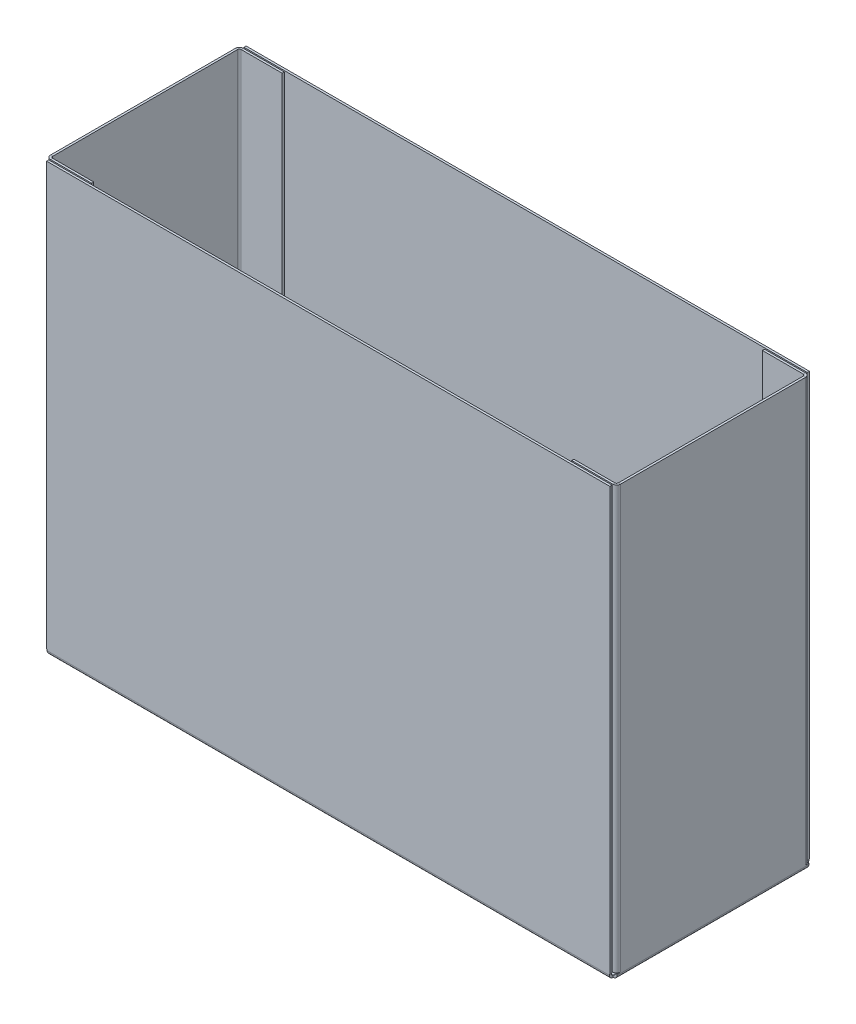
from build123d import *

# Parameters (mm, degrees)
SKETCH1_W                    = 200
SKETCH1_H                    = 70
BOSS_EXTRUDE1_DEPTH          = 150
CONVERT_SOLID1_START         = 1.36
CONVERT_SOLID1_DEPTH         = 197.28
CONVERT_SOLID1_START_2       = -1
CONVERT_SOLID1_2_DEPTH       = 202
CONVERT_SOLID1_3_DEPTH       = 2.184264069
CONVERT_SOLID1_START_3       = 198.815735931
CONVERT_SOLID1_4_DEPTH       = 2.184264069
CONVERT_SOLID1_START_4       = 1.184264069
CONVERT_SOLID1_5_DEPTH       = 197.631471862
CONVERT_SOLID1_6_DEPTH       = 0.175735931
CONVERT_SOLID1_START_5       = 198.64
CONVERT_SOLID1_7_DEPTH       = 0.175735931
CONVERT_SOLID1_START_6       = -68.815735931
CONVERT_SOLID1_8_DEPTH       = 67.631471862
CONVERT_SOLID1_9_DEPTH       = 0.175735931
CONVERT_SOLID1_START_7       = -1.36
CONVERT_SOLID1_10_DEPTH      = 0.175735931
EDGE_FLANGE1_STRIP_W         = 4.24
EDGE_FLANGE1_STRIP_H         = 0.76
EDGE_FLANGE1_STRIP_CUT_DEPTH = 148.269865
EDGE_FLANGE1_DEPTH           = 148.269865
MIRROR2_COPY_1_SKETCH_W      = 4.24
MIRROR2_COPY_1_SKETCH_H      = 0.76
MIRROR2_COPY_1_DEPTH         = 148.269865
MIRROR2_COPY_2_DEPTH         = 148.269865


with BuildPart() as part:
    # Sketch1 → Boss-Extrude1 (new body)
    with BuildSketch(Plane(origin=(0, 0, 0), x_dir=(1, 0, 0), z_dir=(0, 1, 0))):
        with Locations((100, 35)):
            Rectangle(SKETCH1_W, SKETCH1_H)
    extrude(amount=BOSS_EXTRUDE1_DEPTH)

    # Convert-Solid1: read off the stored shape, not the designer's step
    # Convert-Solid1 outline → Convert-Solid1 (cut)
    with BuildSketch(Plane.YZ.offset(CONVERT_SOLID1_START)):
        with BuildLine():
            Line((150, -0.76), (1.36, -0.76))
            ThreePointArc((1.36, -0.76), (0.935735931, -0.935735931), (0.76, -1.36))
            Line((0.76, -1.36), (0.76, -68.64))
            ThreePointArc((0.76, -68.64), (0.935735931, -69.064264069), (1.36, -69.24))
            Line((1.36, -69.24), (150, -69.24))
            Line((150, -69.24), (150, -0.76))
        make_face()
    extrude(amount=CONVERT_SOLID1_DEPTH, mode=Mode.SUBTRACT)

    # Convert-Solid1 2 outline → Convert-Solid1 2 (cut)
    with BuildSketch(Plane.YZ.offset(CONVERT_SOLID1_START_2)):
        with BuildLine():
            Line((0.76, -1.36), (1.730135, -1.36))
            Line((1.730135, -1.36), (1.730135, -1.184264069))
            Line((1.730135, -1.184264069), (150, -1.184264069))
            Line((150, -1.184264069), (150, -0.76))
            Line((150, -0.76), (1.36, -0.76))
            ThreePointArc((1.36, -0.76), (0.935735931, -0.935735931), (0.76, -1.36))
        make_face()
        with BuildLine():
            Line((1.730135, -68.64), (0.76, -68.64))
            ThreePointArc((0.76, -68.64), (0.935735931, -69.064264069), (1.36, -69.24))
            Line((1.36, -69.24), (150, -69.24))
            Line((150, -69.24), (150, -68.815735931))
            Line((150, -68.815735931), (1.730135, -68.815735931))
            Line((1.730135, -68.815735931), (1.730135, -68.64))
        make_face()
    extrude(amount=CONVERT_SOLID1_2_DEPTH, mode=Mode.SUBTRACT)

    # Convert-Solid1 3 outline → Convert-Solid1 3 (cut)
    with BuildSketch(Plane.YZ.offset(CONVERT_SOLID1_START_2)):
        with BuildLine():
            Line((150, -69.24), (1.36, -69.24))
            ThreePointArc((1.36, -69.24), (0.935735931, -69.064264069), (0.76, -68.64))
            Line((0.76, -68.64), (0, -68.64))
            Line((0, -68.64), (0, -70))
            Line((0, -70), (150, -70))
            Line((150, -70), (150, -69.24))
        make_face()
        with BuildLine():
            Line((0, 0), (0, -1.36))
            Line((0, -1.36), (0.76, -1.36))
            ThreePointArc((0.76, -1.36), (0.935735931, -0.935735931), (1.36, -0.76))
            Line((1.36, -0.76), (150, -0.76))
            Line((150, -0.76), (150, 0))
            Line((150, 0), (0, 0))
        make_face()
    extrude(amount=CONVERT_SOLID1_3_DEPTH, mode=Mode.SUBTRACT)

    # Convert-Solid1 4 outline → Convert-Solid1 4 (cut)
    with BuildSketch(Plane.YZ.offset(CONVERT_SOLID1_START_3)):
        with BuildLine():
            Line((150, -69.24), (1.36, -69.24))
            ThreePointArc((1.36, -69.24), (0.935735931, -69.064264069), (0.76, -68.64))
            Line((0.76, -68.64), (0, -68.64))
            Line((0, -68.64), (0, -70))
            Line((0, -70), (150, -70))
            Line((150, -70), (150, -69.24))
        make_face()
        with BuildLine():
            Line((0, 0), (0, -1.36))
            Line((0, -1.36), (0.76, -1.36))
            ThreePointArc((0.76, -1.36), (0.935735931, -0.935735931), (1.36, -0.76))
            Line((1.36, -0.76), (150, -0.76))
            Line((150, -0.76), (150, 0))
            Line((150, 0), (0, 0))
        make_face()
    extrude(amount=CONVERT_SOLID1_4_DEPTH, mode=Mode.SUBTRACT)

    # Convert-Solid1 5 outline → Convert-Solid1 5 (cut)
    with BuildSketch(Plane.YZ.offset(CONVERT_SOLID1_START_4)):
        with BuildLine():
            Line((0, -70), (1.36, -70))
            ThreePointArc((1.36, -70), (0.398334778, -69.601665222), (0, -68.64))
            Line((0, -68.64), (0, -70))
        make_face()
        with BuildLine():
            Line((0, 0), (0, -1.36))
            ThreePointArc((0, -1.36), (0.398334778, -0.398334778), (1.36, 0))
            Line((1.36, 0), (0, 0))
        make_face()
    extrude(amount=CONVERT_SOLID1_5_DEPTH, mode=Mode.SUBTRACT)

    # Convert-Solid1 6 outline → Convert-Solid1 6 (cut)
    with BuildSketch(Plane.YZ.offset(CONVERT_SOLID1_START_4)):
        with BuildLine():
            Line((1.730135, -70), (1.730135, -69.24))
            Line((1.730135, -69.24), (1.36, -69.24))
            ThreePointArc((1.36, -69.24), (0.935735931, -69.064264069), (0.76, -68.64))
            Line((0.76, -68.64), (0, -68.64))
            ThreePointArc((0, -68.64), (0.398334778, -69.601665222), (1.36, -70))
            Line((1.36, -70), (1.730135, -70))
        make_face()
        with BuildLine():
            ThreePointArc((1.36, 0), (0.398334778, -0.398334778), (0, -1.36))
            Line((0, -1.36), (0.76, -1.36))
            ThreePointArc((0.76, -1.36), (0.935735931, -0.935735931), (1.36, -0.76))
            Line((1.36, -0.76), (1.730135, -0.76))
            Line((1.730135, -0.76), (1.730135, 0))
            Line((1.730135, 0), (1.36, 0))
        make_face()
    extrude(amount=CONVERT_SOLID1_6_DEPTH, mode=Mode.SUBTRACT)

    # Convert-Solid1 7 outline → Convert-Solid1 7 (cut)
    with BuildSketch(Plane.YZ.offset(CONVERT_SOLID1_START_5)):
        with BuildLine():
            Line((1.730135, -70), (1.730135, -69.24))
            Line((1.730135, -69.24), (1.36, -69.24))
            ThreePointArc((1.36, -69.24), (0.935735931, -69.064264069), (0.76, -68.64))
            Line((0.76, -68.64), (0, -68.64))
            ThreePointArc((0, -68.64), (0.398334778, -69.601665222), (1.36, -70))
            Line((1.36, -70), (1.730135, -70))
        make_face()
        with BuildLine():
            ThreePointArc((1.36, 0), (0.398334778, -0.398334778), (0, -1.36))
            Line((0, -1.36), (0.76, -1.36))
            ThreePointArc((0.76, -1.36), (0.935735931, -0.935735931), (1.36, -0.76))
            Line((1.36, -0.76), (1.730135, -0.76))
            Line((1.730135, -0.76), (1.730135, 0))
            Line((1.730135, 0), (1.36, 0))
        make_face()
    extrude(amount=CONVERT_SOLID1_7_DEPTH, mode=Mode.SUBTRACT)

    # Convert-Solid1 8 outline → Convert-Solid1 8 (cut)
    with BuildSketch(Plane.XY.offset(CONVERT_SOLID1_START_6)):
        with BuildLine():
            Line((0, 0), (1.36, 0))
            ThreePointArc((1.36, 0), (0.398334778, 0.398334778), (0, 1.36))
            Line((0, 1.36), (0, 0))
        make_face()
        with BuildLine():
            ThreePointArc((200, 1.36), (199.601665222, 0.398334778), (198.64, 0))
            Line((198.64, 0), (200, 0))
            Line((200, 0), (200, 1.36))
        make_face()
        with BuildLine():
            ThreePointArc((0.76, 1.36), (0.935735931, 0.935735931), (1.36, 0.76))
            Line((1.36, 0.76), (1.36, 150))
            Line((1.36, 150), (0.76, 150))
            Line((0.76, 150), (0.76, 1.36))
        make_face()
        with BuildLine():
            ThreePointArc((198.64, 0.76), (199.064264069, 0.935735931), (199.24, 1.36))
            Line((199.24, 1.36), (199.24, 150))
            Line((199.24, 150), (198.64, 150))
            Line((198.64, 150), (198.64, 0.76))
        make_face()
    extrude(amount=CONVERT_SOLID1_8_DEPTH, mode=Mode.SUBTRACT)

    # Convert-Solid1 9 outline → Convert-Solid1 9 (cut)
    with BuildSketch(Plane.XY.offset(CONVERT_SOLID1_START_6)):
        with BuildLine():
            ThreePointArc((0, 1.36), (0.398334778, 0.398334778), (1.36, 0))
            Line((1.36, 0), (1.36, 0.76))
            ThreePointArc((1.36, 0.76), (0.935735931, 0.935735931), (0.76, 1.36))
            Line((0.76, 1.36), (0.76, 1.730135))
            Line((0.76, 1.730135), (0, 1.730135))
            Line((0, 1.730135), (0, 1.36))
        make_face()
        with BuildLine():
            Line((198.64, 0.76), (198.64, 0))
            ThreePointArc((198.64, 0), (199.601665222, 0.398334778), (200, 1.36))
            Line((200, 1.36), (200, 1.730135))
            Line((200, 1.730135), (199.24, 1.730135))
            Line((199.24, 1.730135), (199.24, 1.36))
            ThreePointArc((199.24, 1.36), (199.064264069, 0.935735931), (198.64, 0.76))
        make_face()
    extrude(amount=CONVERT_SOLID1_9_DEPTH, mode=Mode.SUBTRACT)

    # Convert-Solid1 10 outline → Convert-Solid1 10 (cut)
    with BuildSketch(Plane.XY.offset(CONVERT_SOLID1_START_7)):
        with BuildLine():
            ThreePointArc((0, 1.36), (0.398334778, 0.398334778), (1.36, 0))
            Line((1.36, 0), (1.36, 0.76))
            ThreePointArc((1.36, 0.76), (0.935735931, 0.935735931), (0.76, 1.36))
            Line((0.76, 1.36), (0.76, 1.730135))
            Line((0.76, 1.730135), (0, 1.730135))
            Line((0, 1.730135), (0, 1.36))
        make_face()
        with BuildLine():
            Line((198.64, 0.76), (198.64, 0))
            ThreePointArc((198.64, 0), (199.601665222, 0.398334778), (200, 1.36))
            Line((200, 1.36), (200, 1.730135))
            Line((200, 1.730135), (199.24, 1.730135))
            Line((199.24, 1.730135), (199.24, 1.36))
            ThreePointArc((199.24, 1.36), (199.064264069, 0.935735931), (198.64, 0.76))
        make_face()
    extrude(amount=CONVERT_SOLID1_10_DEPTH, mode=Mode.SUBTRACT)

    # Edge-Flange1: sheet metal written as solids
    # Edge-Flange1 strip (on a plane across the edge) → Edge-Flange1 strip cut (cut)
    with BuildSketch(Plane(origin=(199.24, 1.730135, -1.184264069), x_dir=(0, 0, -1), z_dir=(0, 1, 0))):
        with Locations((-0.76, -0.38)):
            Rectangle(EDGE_FLANGE1_STRIP_W, EDGE_FLANGE1_STRIP_H)
    edge_flange1_strip_cut = extrude(amount=EDGE_FLANGE1_STRIP_CUT_DEPTH, mode=Mode.SUBTRACT)

    # Edge-Flange1 section (on a plane across the edge) → Edge-Flange1 (add)
    with BuildSketch(Plane(origin=(199.24, 1.730135, -1.184264069), x_dir=(0, 0, -1), z_dir=(0, 1, 0))):
        with BuildLine():
            Line((0, 0.6), (0, 15))
            Line((0, 15), (0.76, 15))
            Line((0.76, 15), (0.76, 0.6))
            ThreePointArc((0.76, 0.6), (0.935735931, 0.175735931), (1.36, 0))
            Line((1.36, 0), (1.36, -0.76))
            ThreePointArc((1.36, -0.76), (0.398334778, -0.361665222), (0, 0.6))
        make_face()
    edge_flange1 = extrude(amount=EDGE_FLANGE1_DEPTH)

    # Mirror1: Edge-Flange1 strip cut, Edge-Flange1 across plane
    add(edge_flange1_strip_cut.mirror(Plane(origin=(100, 0, 0), x_dir=(0, 0, 1), z_dir=(1, 0, 0))), mode=Mode.SUBTRACT)
    add(edge_flange1.mirror(Plane(origin=(100, 0, 0), x_dir=(0, 0, 1), z_dir=(1, 0, 0))))

    # Mirror2: Edge-Flange1 strip cut, Edge-Flange1 across plane
    add(edge_flange1_strip_cut.mirror(Plane.XY.offset(-35)), mode=Mode.SUBTRACT)
    add(edge_flange1.mirror(Plane.XY.offset(-35)))

    # Mirror2 copy 1 sketch → Mirror2 copy 1 (cut)
    with BuildSketch(Plane(origin=(0.76, 1.730135, -68.815735931), x_dir=(0, 0, 1), z_dir=(0, 1, 0))):
        with Locations((-0.76, -0.38)):
            Rectangle(MIRROR2_COPY_1_SKETCH_W, MIRROR2_COPY_1_SKETCH_H)
    extrude(amount=MIRROR2_COPY_1_DEPTH, mode=Mode.SUBTRACT)

    # Mirror2 copy 2 sketch → Mirror2 copy 2 (add)
    with BuildSketch(Plane(origin=(0.76, 1.730135, -68.815735931), x_dir=(0, 0, 1), z_dir=(0, 1, 0))):
        with BuildLine():
            Line((0, 0.6), (0, 15))
            Line((0, 15), (0.76, 15))
            Line((0.76, 15), (0.76, 0.6))
            ThreePointArc((0.76, 0.6), (0.935735931, 0.175735931), (1.36, 0))
            Line((1.36, 0), (1.36, -0.76))
            ThreePointArc((1.36, -0.76), (0.398334778, -0.361665222), (0, 0.6))
        make_face()
    extrude(amount=MIRROR2_COPY_2_DEPTH)


solid = part.part
